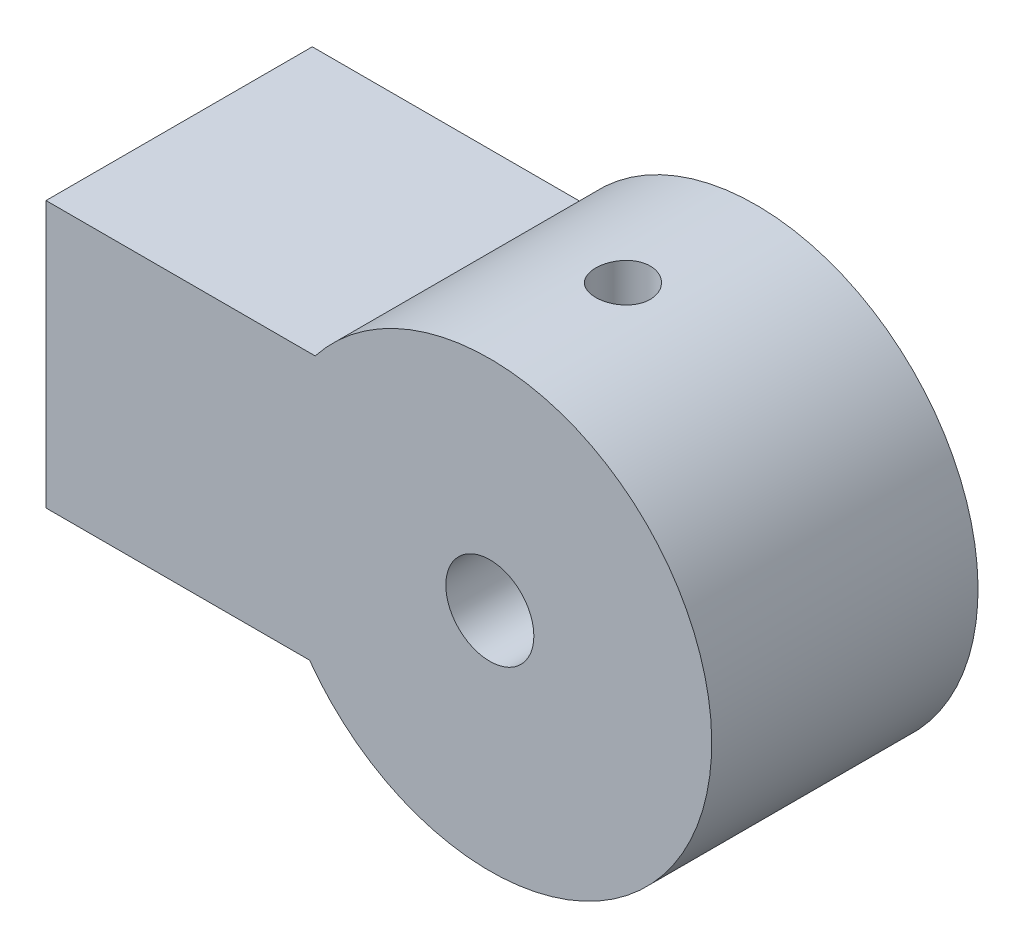
from build123d import *

# Parameters (mm, degrees)
SKETCH1_R               = 3.15
BOSS_EXTRUDE1_DEPTH     = 19.05
CUT_EXTRUDE2_REACH      = 65.708
CUT_EXTRUDE2_END_RADIUS = 3.15
CUT_EXTRUDE2_START      = 6.35
SKETCH3_R               = 1.95


with BuildPart() as part:
    # Sketch1 → Boss-Extrude1 (new body)
    with BuildSketch(Plane.XY):
        with BuildLine():
            Line((0, 19.05), (0, 0))
            Line((0, 0), (18.852664584, 0))
            ThreePointArc((18.852664584, 0), (47.621438813, 8.919808212), (19.256238945, 19.05))
            Line((19.256238945, 19.05), (0, 19.05))
        make_face()
        with Locations((31.75, 9.525)):
            Circle(SKETCH1_R, mode=Mode.SUBTRACT)
    extrude(amount=BOSS_EXTRUDE1_DEPTH)

    # Cut-Extrude2: up to this cylinder (the profile starts outside it)
    cut_extrude2_end = Plane(origin=(31.75, 9.525, 9.525), z_dir=(0, 0, -1)) * Cylinder(CUT_EXTRUDE2_END_RADIUS, 138.716, mode=Mode.PRIVATE)
    # Sketch3 → Cut-Extrude2 (cut, up to the surface)
    with BuildSketch(Plane(origin=(0, 19.05, 0), x_dir=(1, 0, 0), z_dir=(0, 1, 0)).offset(CUT_EXTRUDE2_START), mode=Mode.PRIVATE) as cut_extrude2_sk1:
        with Locations((31.75, -9.525)):
            Circle(SKETCH3_R)
    cut_extrude2_tool1 = extrude(cut_extrude2_sk1.sketch, amount=-CUT_EXTRUDE2_REACH, mode=Mode.PRIVATE) - cut_extrude2_end
    add(cut_extrude2_tool1.solids().sort_by_distance((31.75, 25.4, 9.525))[0], mode=Mode.SUBTRACT)


solid = part.part
